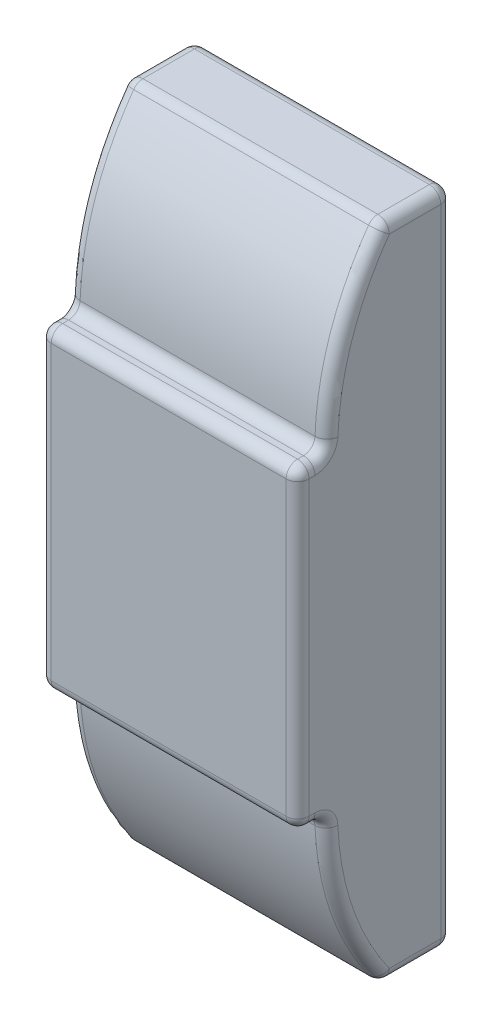
from build123d import *

# Parameters (mm, degrees)
ESQUISSE1_W             = 45
ESQUISSE1_H             = 115
BOSS_EXTRU_1_DEPTH      = 27
ENL_V_MAT_EXTRU_1_DEPTH = 78.847607542
CONG_1_R                = 2


with BuildPart() as part:
    # Esquisse1 → Boss.-Extru.1 (new body)
    with BuildSketch(Plane.XY):
        Rectangle(ESQUISSE1_W, ESQUISSE1_H)
    extrude(amount=BOSS_EXTRU_1_DEPTH)

    # Esquisse2 → Enlèv. mat.-Extru.1 (cut, through all)
    with BuildSketch(Plane.ZY.offset(22.5)):
        with BuildLine():
            Line((30.871803653, 27.5), (22, 27.5))
            ThreePointArc((22, 27.5), (19.434164903, 43.311388301), (12, 57.5))
            Line((12, 57.5), (30.871803653, 57.5))
            Line((30.871803653, 57.5), (30.871803653, 27.5))
        make_face()
    enl_v_mat_extru_1 = extrude(amount=-ENL_V_MAT_EXTRU_1_DEPTH, mode=Mode.SUBTRACT)

    # Symétrie1: Enlèv. mat.-Extru.1 across plane
    add(enl_v_mat_extru_1.mirror(Plane.ZX), mode=Mode.SUBTRACT)

    # Congé1
    cong_1_edges = [part.edges().sort_by_distance(p)[0] for p in [
        (22.5, -27.5, 24.5),
        (22.5, 27.5, 24.5),
        (22.5, 0, 0),
        (0, 57.5, 0),
        (22.5, 57.5, 6),
        (0, 57.5, 12),
        (22.5, 43.311388301, 19.434164903),
        (0, 27.5, 22),
        (22.5, -57.5, 6),
        (0, -57.5, 0),
        (-22.5, -57.5, 6),
        (-22.5, 0, 0),
        (-22.5, 57.5, 6),
        (-22.5, 43.311388301, 19.434164903),
        (-22.5, 27.5, 24.5),
        (-22.5, -27.5, 24.5),
        (0, -27.5, 22),
        (22.5, -43.311388301, 19.434164903),
        (0, -57.5, 12),
        (-22.5, -43.311388301, 19.434164903),
        (0, 27.5, 27),
        (22.5, 0, 27),
        (0, -27.5, 27),
        (-22.5, 0, 27),
    ]]
    fillet(cong_1_edges, radius=CONG_1_R)


solid = part.part
